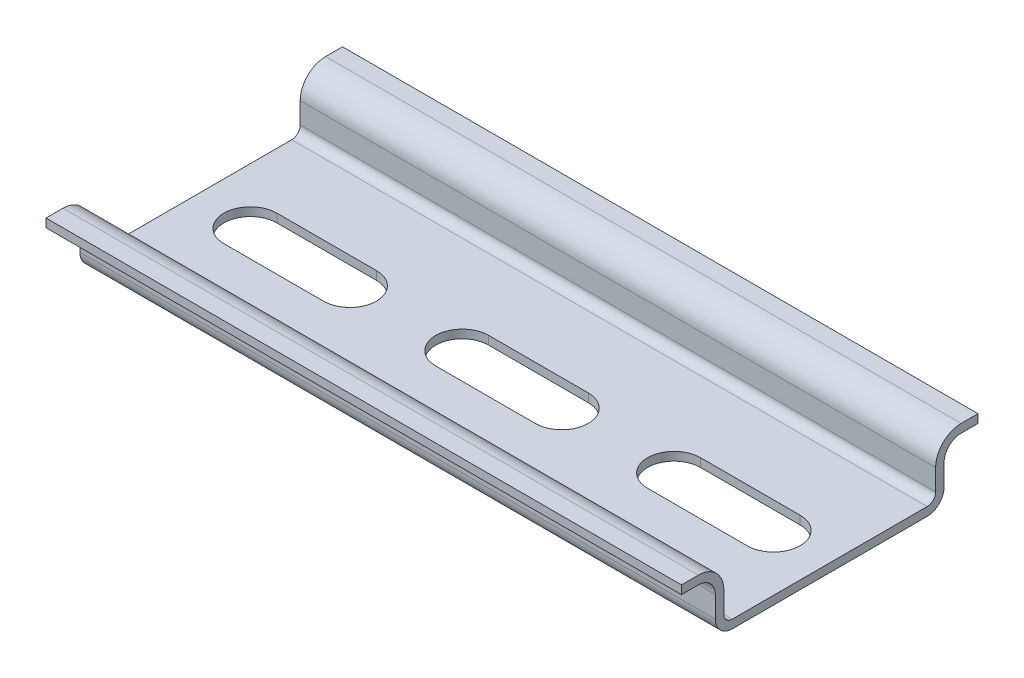
from build123d import *

# Parameters (mm, degrees)
EXTRUDE_THIN1_DEPTH      = 37.5
EXTRUDE_THIN1_DEPTH_BACK = 37.5
CUT_EXTRUDE1_REACH       = 44.057
LPATTERN1_COUNT          = 2
LPATTERN1_PITCH          = 25
LPATTERN1_COUNT_DIR2     = 2
LPATTERN1_PITCH_DIR2     = 25


with BuildPart() as part:
    # Sketch1 → Extrude-Thin1 (new, two sides: drawn at the far end of the back side and taken through both)
    with BuildSketch(Plane(origin=(0, 0, 0), x_dir=(0, 0, -1), z_dir=(1, 0, 0)).offset(-EXTRUDE_THIN1_DEPTH_BACK)):
        with BuildLine():
            Line((-17.5, 6.5), (-15.5, 6.5))
            ThreePointArc((-15.5, 6.5), (-14.085786438, 5.914213562), (-13.5, 4.5))
            Line((-13.5, 4.5), (-13.5, 2))
            ThreePointArc((-13.5, 2), (-12.914213562, 0.585786438), (-11.5, 0))
            Line((-11.5, 0), (11.5, 0))
            ThreePointArc((11.5, 0), (12.914213562, 0.585786438), (13.5, 2))
            Line((13.5, 2), (13.5, 4.5))
            ThreePointArc((13.5, 4.5), (14.085786438, 5.914213562), (15.5, 6.5))
            Line((15.5, 6.5), (17.5, 6.5))
            Line((17.5, 6.5), (17.5, 7.5))
            Line((17.5, 7.5), (15.5, 7.5))
            ThreePointArc((15.5, 7.5), (13.378679656, 6.621320344), (12.5, 4.5))
            Line((12.5, 4.5), (12.5, 2))
            ThreePointArc((12.5, 2), (12.207106781, 1.292893219), (11.5, 1))
            Line((11.5, 1), (-11.5, 1))
            ThreePointArc((-11.5, 1), (-12.207106781, 1.292893219), (-12.5, 2))
            Line((-12.5, 2), (-12.5, 4.5))
            ThreePointArc((-12.5, 4.5), (-13.378679656, 6.621320344), (-15.5, 7.5))
            Line((-15.5, 7.5), (-17.5, 7.5))
            Line((-17.5, 7.5), (-17.5, 6.5))
        make_face()
    extrude(amount=EXTRUDE_THIN1_DEPTH + EXTRUDE_THIN1_DEPTH_BACK)

    # Sketch2 → Cut-Extrude1 (cut, up to next)
    with BuildSketch(Plane.XZ, mode=Mode.PRIVATE) as cut_extrude1_sk1:
        with BuildLine():
            Line((-5.875, 3.125), (5.875, 3.125))
            ThreePointArc((5.875, 3.125), (9, 0), (5.875, -3.125))
            Line((5.875, -3.125), (-5.875, -3.125))
            ThreePointArc((-5.875, -3.125), (-9, 0), (-5.875, 3.125))
        make_face()
    cut_extrude1_tool1 = extrude(cut_extrude1_sk1.sketch, amount=-CUT_EXTRUDE1_REACH, mode=Mode.PRIVATE) & part.part
    cut_extrude1 = cut_extrude1_tool1.solids().sort_by_distance((0, 0, 0))[0]
    add(cut_extrude1, mode=Mode.SUBTRACT)

    # LPattern1: Cut-Extrude1 2 × 2
    with Locations(*[Vector(1, 0, 0) * (i * LPATTERN1_PITCH) + Vector(-1, 0, 0) * (j * LPATTERN1_PITCH_DIR2) for i in range(LPATTERN1_COUNT) for j in range(LPATTERN1_COUNT_DIR2) if (i, j) != (0, 0)]):
        add(cut_extrude1, mode=Mode.SUBTRACT)


solid = part.part
